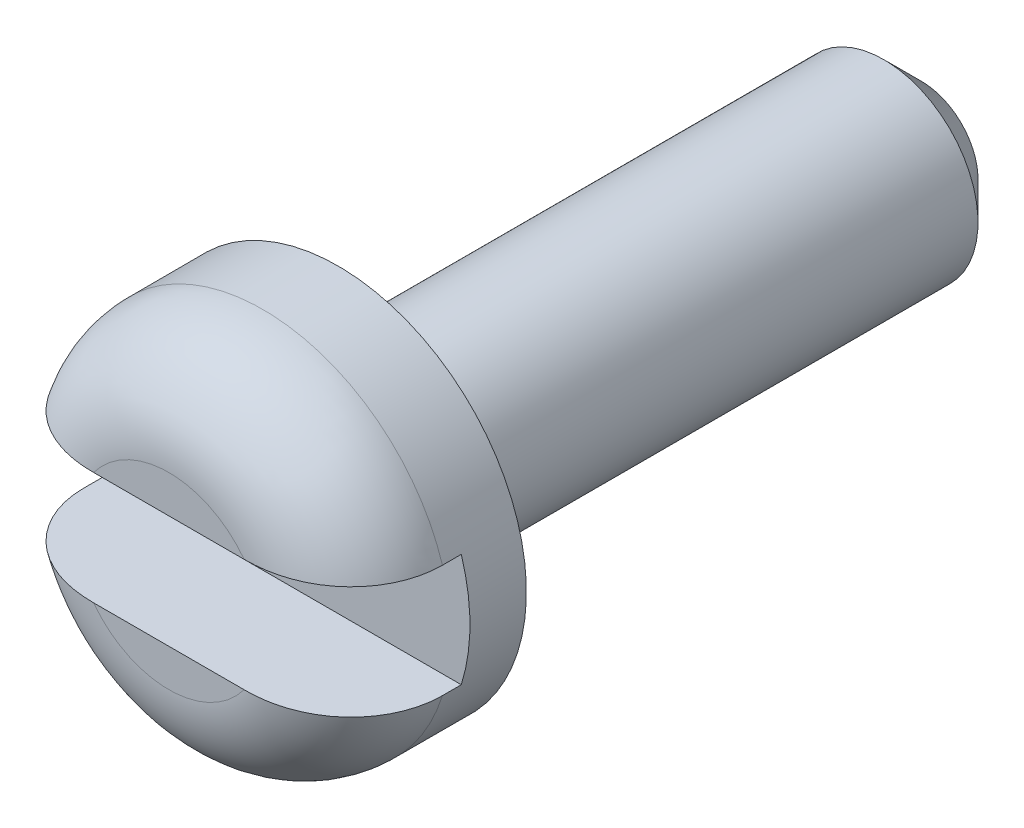
from build123d import *

# Parameters (mm, degrees)
CUT_EXTRUDE_1_DEPTH      = 9.485281374
CUT_EXTRUDE_1_DEPTH_BACK = 9.485281374
SKETCH_2_W               = 1.2
SKETCH_2_H               = 1.2
CHAMFER_1_SIZE           = 0.4
FILLET_1_R               = 1
FILLET_2_R               = 0.4


with BuildPart() as part:
    # Эскиз1 → Повернуть1 (revolve)
    with BuildSketch(Plane(origin=(0, 0, 0), x_dir=(1, 0, 0), z_dir=(0, 1, 0))):
        Polygon((0, 0), (-2, 0), (-2, 1.8), (-1, 1.8), (-1, 8), (0, 8), align=None)
    revolve(axis=Axis((0, 0, -8), (0, 0, 1)))

    # Эскиз2 → Вырез-Вытянуть1 (cut, two sides: drawn at the far end of the back side and taken through both)
    with BuildSketch(Plane(origin=(0, 0, 0), x_dir=(0, 0, -1), z_dir=(1, 0, 0)).offset(-CUT_EXTRUDE_1_DEPTH_BACK)):
        with Locations((0.6, 0)):
            Rectangle(SKETCH_2_W, SKETCH_2_H)
    extrude(amount=CUT_EXTRUDE_1_DEPTH + CUT_EXTRUDE_1_DEPTH_BACK, mode=Mode.SUBTRACT)

    # Фаска1
    chamfer_1_edges = [part.edges().sort_by_distance(p)[0] for p in [
        (1, 0, -8),
    ]]
    chamfer(chamfer_1_edges, length=CHAMFER_1_SIZE)

    # Скругление1
    fillet_1_edges = [part.edges().sort_by_distance(p)[0] for p in [
        (0, -2, 0),
        (0, 2, 0),
    ]]
    fillet(fillet_1_edges, radius=FILLET_1_R)

    # Скругление2
    fillet_2_edges = [part.edges().sort_by_distance(p)[0] for p in [
        (1, 0, -1.8),
    ]]
    fillet(fillet_2_edges, radius=FILLET_2_R)


solid = part.part
